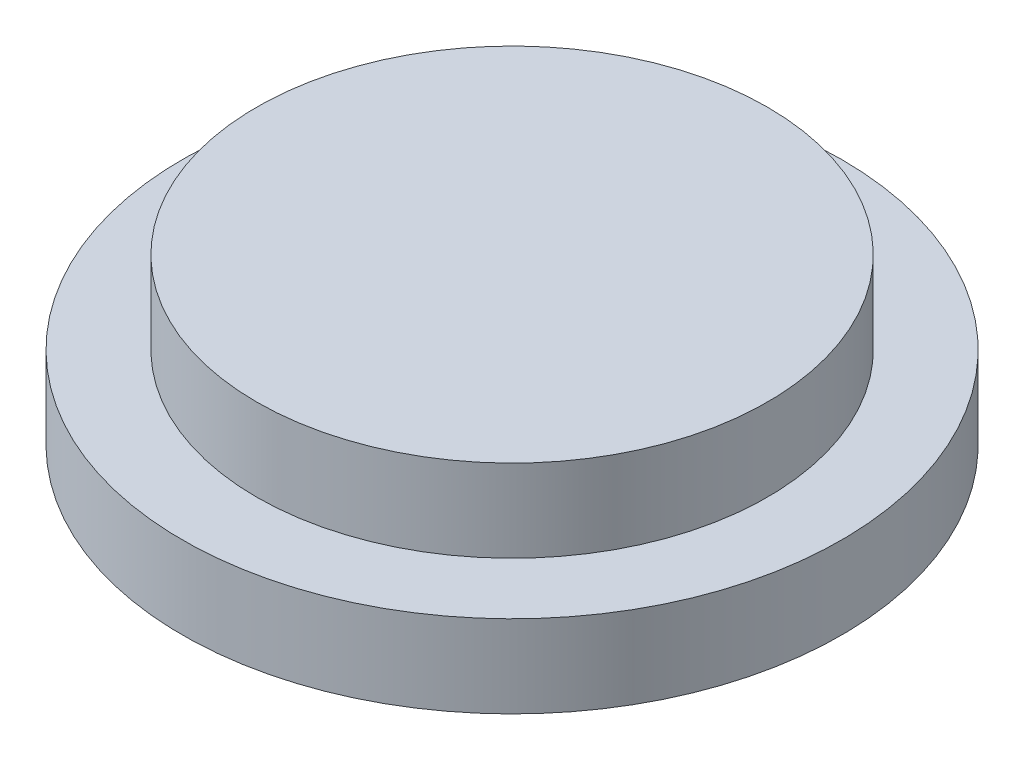
from build123d import *

# Parameters (mm, degrees)
SKETCH1_R           = 31
BOSS_EXTRUDE1_DEPTH = 10
BOSS_EXTRUDE3_DEPTH = 10
CUT_EXTRUDE2_DEPTH  = 53.364109846
SKETCH8_R           = 40
BOSS_EXTRUDE4_DEPTH = 10


with BuildPart() as part:
    # Sketch1 → Boss-Extrude1 (new body)
    with BuildSketch(Plane(origin=(0, 0, 0), x_dir=(1, 0, 0), z_dir=(0, 1, 0))):
        Circle(SKETCH1_R)
    extrude(amount=BOSS_EXTRUDE1_DEPTH)

    # Sketch6 → Boss-Extrude3 (add)
    with BuildSketch(Plane(origin=(0, 0, 0), x_dir=(-1, 0, 0), z_dir=(0, -1, 0))):
        Polygon((15, 0), (15, -10), (-15, -10), (-15, 0), (-15, 10), (15, 10), align=None)
    extrude(amount=BOSS_EXTRUDE3_DEPTH)

    # Sketch7 → Cut-Extrude2 (cut, through all)
    with BuildSketch(Plane(origin=(0, 0, -10), x_dir=(-1, 0, 0), z_dir=(0, 0, -1))):
        Polygon((10, -5), (5, -5), (5, 0), (15, 0), (15, -10), align=None)
        Polygon((-5, 0), (-15, 0), (-15, -10), (-10, -5), (-5, -5), align=None)
    extrude(amount=-CUT_EXTRUDE2_DEPTH, mode=Mode.SUBTRACT)

    # Sketch8 → Boss-Extrude4 (add)
    with BuildSketch(Plane.XZ):
        Circle(SKETCH8_R)
        Polygon((15, -10), (22.5, -10), (22.5, 10), (15, 10), (-15, 10), (-22.5, 10), (-22.5, -10), (-15, -10), align=None, mode=Mode.SUBTRACT)
    extrude(amount=BOSS_EXTRUDE4_DEPTH)


solid = part.part
